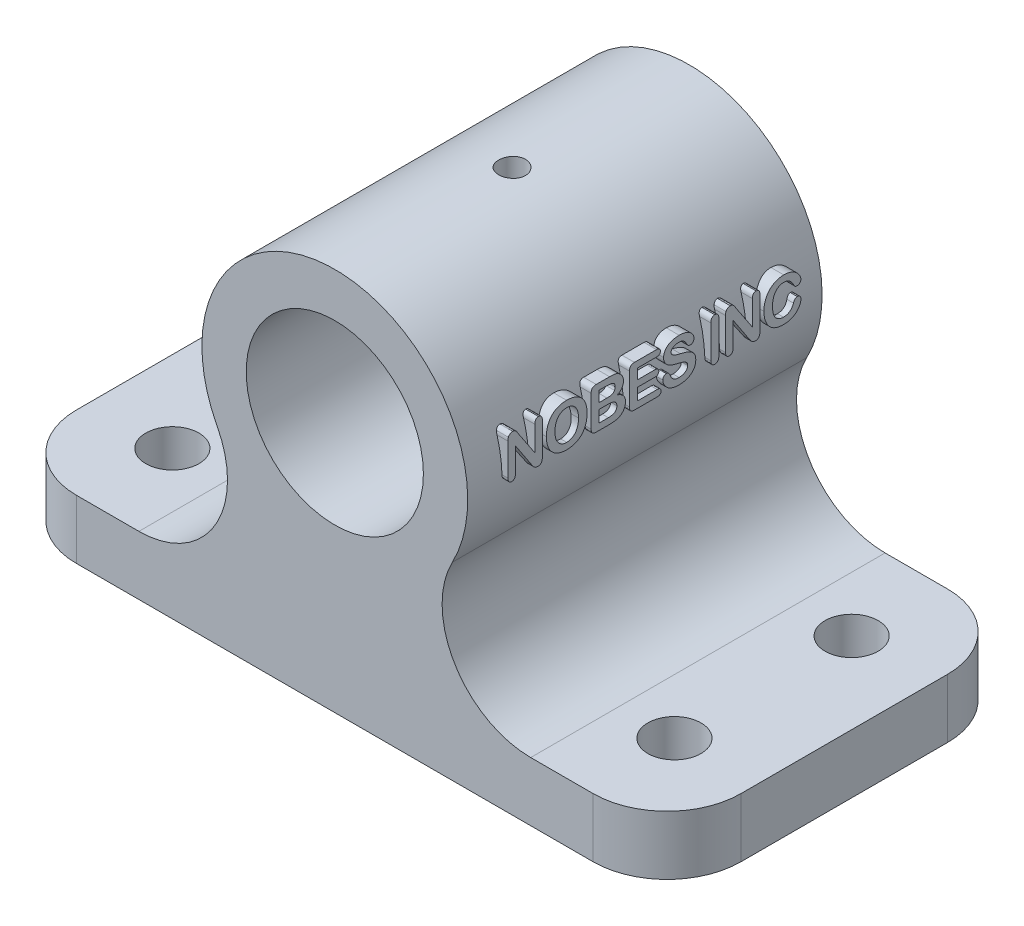
from build123d import *

# Parameters (mm, degrees)
SKETCH1_R                            = 30
MAIN_BODY_DEPTH                      = 120
FILLET1_R                            = 25
F_18_0_18_DIAMETER_HOLE1_D           = 18
LPATTERN1_COUNT                      = 2
LPATTERN1_PITCH                      = 170
LPATTERN1_COUNT_DIR2                 = 2
LPATTERN1_PITCH_DIR2                 = 60
NAME_PLATE_DEPTH                     = 7
F_1_8_27_START                       = 114.653472486
F_1_8_27_NPSM_TAPPED_HOLE1_OUTLINE_R = 4.5466
F_1_8_27_NPSM_TAPPED_HOLE1_DEPTH     = 15.346527614


# Read off the part's stored shape, not the designer's step: 1/8-27 NPSM Tapped Hole1
with BuildPart() as part:
    # Sketch1 → Main Body (new body)
    with BuildSketch(Plane.XY):
        with BuildLine():
            Line((-112.5, 0), (112.5, 0))
            Line((112.5, 0), (112.5, 20))
            Line((112.5, 20), (66.332495807, 20))
            ThreePointArc((66.332495807, 20), (40.64203065, 34.508066615), (39.799497484, 64))
            ThreePointArc((39.799497484, 64), (0, 130), (-39.799497484, 64))
            ThreePointArc((-39.799497484, 64), (-40.64203065, 34.508066615), (-66.332495807, 20))
            Line((-66.332495807, 20), (-112.5, 20))
            Line((-112.5, 20), (-112.5, 0))
        make_face()
        with Locations((0, 85)):
            Circle(SKETCH1_R, mode=Mode.SUBTRACT)
    extrude(amount=MAIN_BODY_DEPTH)

    # Fillet1
    fillet1_edges = [part.edges().sort_by_distance(p)[0] for p in [
        (112.5, 10, 120),
        (-112.5, 10, 0),
        (-112.5, 10, 120),
        (112.5, 10, 0),
    ]]
    fillet(fillet1_edges, radius=FILLET1_R)

    # Ø18.0 (18) Diameter Hole1 (through all)
    with Locations(Plane(origin=(-85, 20, 30), x_dir=(1, 0, 0), z_dir=(0, 1, 0))):
        with Locations((0, 0)):
            f_18_0_18_diameter_hole1 = Hole(F_18_0_18_DIAMETER_HOLE1_D / 2)

    # LPattern1: 18.0 _18_ Diameter Hole1 2 × 2
    with Locations(*[(i * LPATTERN1_PITCH, 0, j * LPATTERN1_PITCH_DIR2) for i in range(LPATTERN1_COUNT) for j in range(LPATTERN1_COUNT_DIR2) if (i, j) != (0, 0)]):
        add(f_18_0_18_diameter_hole1, mode=Mode.SUBTRACT)

    # Sketch5 → Name PLate (add)
    # profile 1 of 8: a face of its own
    with BuildSketch(Plane(origin=(40, 0, 0), x_dir=(0, 0, -1), z_dir=(1, 0, 0))):
        with BuildLine():
            Line((-104.804677582, 97.647629166), (-99.28003418, 89.360664063))
            Line((-99.28003418, 89.360664063), (-99.28003418, 97.724281464))
            add(Edge.make_bspline(
                [(-99.28003418, 97.724281464), (-99.275769192, 97.852300946), (-99.267780679, 98.092087141), (-99.207091884, 98.428290028), (-99.100752252, 98.7134846), (-98.950061339, 98.947686684), (-98.762706902, 99.130863217), (-98.541490145, 99.260993628), (-98.290762072, 99.340741553), (-98.113819267, 99.349385189), (-98.022368698, 99.353852539)],
                knots=[0, 0, 0, 0, 1.319117216, 2.470765316, 3.505116792, 4.43580569, 5.318756254, 6.18027265, 7.059497782, 8, 8, 8, 8], degree=3))
            add(Edge.make_bspline(
                [(-98.022368698, 99.353852539), (-97.928135636, 99.349301303), (-97.745739051, 99.340491975), (-97.48779661, 99.262367356), (-97.26235402, 99.13088627), (-97.072034794, 98.94795549), (-96.918596932, 98.71374537), (-96.808523296, 98.428899447), (-96.748809224, 98.092004635), (-96.740662782, 97.852272229), (-96.736313477, 97.724281464)],
                knots=[0, 0, 0, 0, 0.959871134, 1.857917088, 2.719075999, 3.600089629, 4.526699118, 5.554128738, 6.694173474, 8, 8, 8, 8], degree=3))
            Line((-96.736313477, 97.724281464), (-96.736313477, 86.669316711))
            add(Edge.make_bspline(
                [(-96.736313477, 86.669316711), (-96.739820547, 86.524206642), (-96.746402913, 86.251851836), (-96.81653059, 85.871028503), (-96.934795959, 85.546877405), (-97.100267179, 85.277926582), (-97.318051368, 85.066918994), (-97.587286681, 84.92188317), (-97.901195952, 84.831298278), (-98.125796777, 84.82278093), (-98.24380867, 84.818305664)],
                knots=[0, 0, 0, 0, 1.276164049, 2.395212213, 3.391561633, 4.297456637, 5.151673506, 6.027862746, 6.963780962, 8, 8, 8, 8], degree=3))
            add(Edge.make_bspline(
                [(-98.24380867, 84.818305664), (-98.36345432, 84.823919407), (-98.594218759, 84.834746814), (-98.926658891, 84.913796562), (-99.228921131, 85.061272323), (-99.50050963, 85.274513134), (-99.754759619, 85.53313818), (-99.987485044, 85.833118749), (-100.206745662, 86.158120838), (-100.356811708, 86.376998105), (-100.432657623, 86.487622375)],
                knots=[0, 0, 0, 0, 0.990229924, 1.909888509, 2.806876858, 3.75171819, 4.754420985, 5.802993103, 6.889595585, 8, 8, 8, 8], degree=3))
            Line((-100.432657623, 86.487622375), (-105.821030273, 94.629799805))
            Line((-105.821030273, 94.629799805), (-105.821030273, 86.439359818))
            add(Edge.make_bspline(
                [(-105.821030273, 86.439359818), (-105.825285388, 86.314191374), (-105.833345658, 86.07709048), (-105.895582393, 85.743685823), (-106.01007548, 85.459013677), (-106.167380468, 85.224909967), (-106.360551242, 85.042761682), (-106.581387165, 84.911627749), (-106.829199561, 84.831654192), (-107.003335632, 84.822839103), (-107.092890625, 84.818305664)],
                knots=[0, 0, 0, 0, 1.293064309, 2.449392962, 3.484384031, 4.441729672, 5.340986808, 6.204611779, 7.076664708, 8, 8, 8, 8], degree=3))
            add(Edge.make_bspline(
                [(-107.092890625, 84.818305664), (-107.184348601, 84.822669428), (-107.362497058, 84.831169484), (-107.614668655, 84.913324424), (-107.836456637, 85.048906265), (-108.030141425, 85.232082861), (-108.180846561, 85.470602294), (-108.288488586, 85.755287785), (-108.353139992, 86.086366752), (-108.360728935, 86.322649778), (-108.364750977, 86.44787674)],
                knots=[0, 0, 0, 0, 0.938889884, 1.828837584, 2.693878765, 3.596100726, 4.546832571, 5.570326044, 6.712304089, 8, 8, 8, 8], degree=3))
            Line((-108.364750977, 86.44787674), (-108.364750977, 97.292757416))
            add(Edge.make_bspline(
                [(-108.364750977, 97.292757416), (-108.363685882, 97.401688282), (-108.361671889, 97.60766629), (-108.331883202, 97.89769749), (-108.291176992, 98.152952691), (-108.240716858, 98.305787767), (-108.217124329, 98.377245483)],
                knots=[0, 0, 0, 0, 1.18793306, 2.246269525, 3.180047019, 4, 4, 4, 4], degree=3))
            add(Edge.make_bspline(
                [(-108.217124329, 98.377245483), (-108.185466238, 98.446776893), (-108.122262625, 98.58559248), (-107.983671919, 98.769528518), (-107.825490661, 98.94095732), (-107.634593653, 99.08218872), (-107.428620823, 99.202221258), (-107.21017547, 99.290935429), (-106.98186866, 99.34419169), (-106.827249873, 99.350616585), (-106.749374771, 99.353852539)],
                knots=[0, 0, 0, 0, 0.980600708, 1.957714689, 2.948627098, 3.97434472, 5.000279326, 6.011426356, 6.998437519, 8, 8, 8, 8], degree=3))
            add(Edge.make_bspline(
                [(-106.749374771, 99.353852539), (-106.633006733, 99.349222904), (-106.414795405, 99.340541492), (-106.113908987, 99.240045627), (-105.857765649, 99.092727669), (-105.636264183, 98.891644151), (-105.426828771, 98.643131131), (-105.23272042, 98.33675322), (-105.022523755, 98.000170985), (-104.878400616, 97.766935612), (-104.804677582, 97.647629166)],
                knots=[0, 0, 0, 0, 1.01695463, 1.906975685, 2.751376853, 3.592506721, 4.517315556, 5.594915983, 6.76973195, 8, 8, 8, 8], degree=3))
        make_face()
    # profile 2 of 8: a face of its own
    with BuildSketch(Plane(origin=(40, 0, 0), x_dir=(0, 0, -1), z_dir=(1, 0, 0))):
        with BuildLine():
            add(Edge.make_bspline(
                [(-88.517483749, 99.353852539), (-88.337584413, 99.351327107), (-87.984836009, 99.346375214), (-87.465623135, 99.301487649), (-86.96486712, 99.234860775), (-86.482906984, 99.138958804), (-86.020938349, 99.013820651), (-85.578873243, 98.860023686), (-85.15614202, 98.678077324), (-84.75225028, 98.471551288), (-84.371634801, 98.237764501), (-84.011872228, 97.982106556), (-83.677037518, 97.700826805), (-83.366350157, 97.396394318), (-83.081792386, 97.067978439), (-82.819227331, 96.71740267), (-82.580677572, 96.342694961), (-82.368712359, 95.943934934), (-82.17827594, 95.52708086), (-82.012964386, 95.090911), (-81.874988812, 94.637273209), (-81.760222895, 94.165416043), (-81.67324194, 93.676030116), (-81.611973923, 93.167969283), (-81.56955789, 92.643237494), (-81.566425533, 92.286786563), (-81.564836426, 92.10595192)],
                knots=[0, 0, 0, 0, 1.137132438, 2.22970057, 3.292424762, 4.329649132, 5.333981859, 6.315987487, 7.286185149, 8.241436353, 9.181332131, 10.107725602, 11.0292572, 11.943085262, 12.854854597, 13.773819033, 14.709898734, 15.660115542, 16.626635295, 17.605574315, 18.606712189, 19.622473761, 20.67399022, 21.747038223, 22.857027702, 24, 24, 24, 24], degree=3))
            add(Edge.make_bspline(
                [(-81.564836426, 92.10595192), (-81.570382149, 91.840779714), (-81.581263506, 91.320480868), (-81.663802125, 90.55877279), (-81.803721287, 89.833692768), (-81.994280785, 89.145534922), (-82.244746168, 88.499063426), (-82.549464395, 87.89512726), (-82.911433311, 87.33664155), (-83.32675324, 86.824111168), (-83.793836113, 86.360439394), (-84.315872993, 85.956224367), (-84.88962659, 85.611226023), (-85.510000354, 85.320627048), (-86.180710026, 85.091668701), (-86.900397567, 84.937738856), (-87.664617812, 84.832972381), (-88.190627523, 84.823281429), (-88.460704269, 84.818305664)],
                knots=[0, 0, 0, 0, 1.119700056, 2.196982321, 3.230778928, 4.235358115, 5.208318876, 6.153781848, 7.087131445, 8.013361148, 8.934611457, 9.860297843, 10.794468433, 11.756326826, 12.748403726, 13.780058436, 14.860183413, 16, 16, 16, 16], degree=3))
            add(Edge.make_bspline(
                [(-88.460704269, 84.818305664), (-88.72883514, 84.824761134), (-89.253749976, 84.837398887), (-90.018951277, 84.93866832), (-90.742469594, 85.101574655), (-91.42017402, 85.334500288), (-92.047330693, 85.6311208), (-92.626569284, 85.976385784), (-93.146651879, 86.384255465), (-93.614258846, 86.843087481), (-94.029352923, 87.353605495), (-94.382248018, 87.918339847), (-94.693472699, 88.524999292), (-94.939474923, 89.182582306), (-95.135195974, 89.876822816), (-95.273136548, 90.602545949), (-95.35724119, 91.355420208), (-95.368093437, 91.866311703), (-95.373605957, 92.125824738)],
                knots=[0, 0, 0, 0, 1.130091603, 2.212359386, 3.247930852, 4.252250901, 5.226719473, 6.16821431, 7.089197795, 8.00610207, 8.925165125, 9.855999165, 10.808795857, 11.79501972, 12.810514548, 13.846493258, 14.906102224, 16, 16, 16, 16], degree=3))
            add(Edge.make_bspline(
                [(-95.373605957, 92.125824738), (-95.368605529, 92.390111017), (-95.358772898, 92.909792403), (-95.267992535, 93.671177759), (-95.124662839, 94.400121624), (-94.920369867, 95.092954256), (-94.661343946, 95.744808482), (-94.34694092, 96.348575439), (-93.982928281, 96.902383673), (-93.566897212, 97.405179186), (-93.098187051, 97.853900841), (-92.579420005, 98.24632926), (-92.013149643, 98.583900844), (-91.399349943, 98.861558811), (-90.740813464, 99.084415967), (-90.037711476, 99.241759835), (-89.291365859, 99.337081064), (-88.779906348, 99.34816535), (-88.517483749, 99.353852539)],
                knots=[0, 0, 0, 0, 1.125218611, 2.212582392, 3.260701818, 4.286054269, 5.284468473, 6.243521648, 7.180287843, 8.101949555, 9.017004541, 9.937572836, 10.866572707, 11.818894766, 12.801573564, 13.82236102, 14.882684417, 16, 16, 16, 16], degree=3))
        make_face()
        with BuildLine():
            add(Edge.make_bspline(
                [(-84.471945801, 92.125824738), (-84.47749754, 92.378806646), (-84.488246995, 92.86863825), (-84.583516947, 93.577215725), (-84.737824848, 94.234456256), (-84.921740614, 94.743358829), (-85.098345245, 95.12058141), (-85.242577904, 95.383129447), (-85.397729789, 95.630305923), (-85.573823752, 95.853875821), (-85.756487156, 96.064504191), (-85.954252899, 96.2572242), (-86.167465493, 96.429166306), (-86.466247678, 96.637861495), (-86.868607256, 96.854106381), (-87.388117195, 97.039405572), (-87.941895454, 97.15359428), (-88.32293407, 97.166785414), (-88.517483749, 97.173520508)],
                knots=[0, 0, 0, 0, 1.663767962, 3.22144036, 4.693807908, 6.09809827, 6.772124886, 7.43249818, 8.068074837, 8.689496673, 9.30272399, 9.901527182, 10.503429657, 11.102750509, 12.297797107, 13.495176895, 14.721094103, 16, 16, 16, 16], degree=3))
            add(Edge.make_bspline(
                [(-88.517483749, 97.173520508), (-88.656842471, 97.17005393), (-88.932271691, 97.163202568), (-89.336591849, 97.098135873), (-89.724979584, 96.996378529), (-90.095627902, 96.854054432), (-90.445235877, 96.67229926), (-90.772239507, 96.451636288), (-91.072695605, 96.192924552), (-91.34828595, 95.897211667), (-91.597363617, 95.561517908), (-91.818341885, 95.182361103), (-92.010879749, 94.759736153), (-92.175025666, 94.297414046), (-92.304849026, 93.797772121), (-92.39716001, 93.266048872), (-92.455149633, 92.705307081), (-92.462658013, 92.321858309), (-92.466496582, 92.125824738)],
                knots=[0, 0, 0, 0, 0.926902171, 1.831933723, 2.71800685, 3.595261319, 4.468550136, 5.334998465, 6.214894287, 7.1017058, 8.020008637, 8.99111482, 10.01694856, 11.106630737, 12.25237115, 13.448355624, 14.695502513, 16, 16, 16, 16], degree=3))
            add(Edge.make_bspline(
                [(-92.466496582, 92.125824738), (-92.462647417, 91.927902067), (-92.455116858, 91.540683488), (-92.397245589, 90.974251457), (-92.304332011, 90.436073224), (-92.175435731, 89.928376194), (-92.008680489, 89.457079223), (-91.808500031, 89.02650081), (-91.584088797, 88.633569686), (-91.319349244, 88.289242084), (-91.033386302, 87.985389756), (-90.726060568, 87.720736367), (-90.399589657, 87.495279564), (-90.050847279, 87.311736034), (-89.68174531, 87.174021118), (-89.296363949, 87.069650991), (-88.892201328, 87.010037727), (-88.617035341, 87.00246914), (-88.477738113, 86.998637695)],
                knots=[0, 0, 0, 0, 1.300369924, 2.54406124, 3.737115199, 4.88637188, 5.981883645, 7.016846829, 8.003376514, 8.948590554, 9.863559023, 10.741055788, 11.608647785, 12.46534091, 13.323432129, 14.192248925, 15.0848625, 16, 16, 16, 16], degree=3))
            add(Edge.make_bspline(
                [(-88.477738113, 86.998637695), (-88.298326414, 87.004646722), (-87.944824468, 87.016486543), (-87.42720414, 87.127034257), (-86.932653385, 87.300844902), (-86.541076411, 87.500972607), (-86.245954545, 87.698110759), (-86.032689016, 87.864427522), (-85.834427063, 88.053688048), (-85.64544727, 88.258586481), (-85.470332722, 88.483590625), (-85.304535068, 88.725847015), (-85.151458204, 88.987945533), (-85.009835502, 89.268420784), (-84.881940436, 89.566762535), (-84.770386351, 89.882178478), (-84.681457718, 90.216055226), (-84.603843224, 90.565292063), (-84.544798149, 90.932186152), (-84.502811289, 91.314980104), (-84.476503813, 91.714750801), (-84.47348872, 91.98667331), (-84.471945801, 92.125824738)],
                knots=[0, 0, 0, 0, 1.468568495, 2.893578421, 4.316075305, 5.755382189, 6.482330971, 7.222315454, 7.968369796, 8.725783183, 9.504530818, 10.302500265, 11.129737207, 11.9897977, 12.875655565, 13.787998707, 14.728608307, 15.705132475, 16.718642732, 17.771954593, 18.859838044, 20, 20, 20, 20], degree=3))
        make_face(mode=Mode.SUBTRACT)
    # profile 3 of 8: a face of its own
    with BuildSketch(Plane(origin=(40, 0, 0), x_dir=(0, 0, -1), z_dir=(1, 0, 0))):
        with BuildLine():
            Line((-74.223249664, 85), (-78.487388611, 85))
            add(Edge.make_bspline(
                [(-78.487388611, 85), (-78.562194975, 85.000763884), (-78.705478808, 85.002227025), (-78.91244954, 85.022358176), (-79.102145449, 85.056313788), (-79.276144912, 85.101221206), (-79.434383588, 85.158147864), (-79.576926764, 85.227455387), (-79.700125646, 85.315167492), (-79.847826283, 85.444883294), (-79.996940134, 85.656181978), (-80.116429591, 85.965020037), (-80.189719342, 86.331900674), (-80.197802672, 86.596068357), (-80.202128906, 86.737452087)],
                knots=[0, 0, 0, 0, 0.950729654, 1.821024047, 2.639907261, 3.398604693, 4.102683231, 4.775219685, 5.406000082, 6.019447712, 7.268382492, 8.644570224, 10.204158913, 12, 12, 12, 12], degree=3))
            Line((-80.202128906, 86.737452087), (-80.202128906, 97.25301178))
            add(Edge.make_bspline(
                [(-80.202128906, 97.25301178), (-80.198193204, 97.397297808), (-80.190876216, 97.665544473), (-80.113830527, 98.036065169), (-79.992103911, 98.345800849), (-79.809069281, 98.595284152), (-79.562402087, 98.779206052), (-79.255652921, 98.902840089), (-78.891332167, 98.978511448), (-78.627858049, 98.986307471), (-78.487388611, 98.990463867)],
                knots=[0, 0, 0, 0, 1.222174323, 2.272182497, 3.193385757, 4.024939207, 4.86132091, 5.767718531, 6.809874283, 8, 8, 8, 8], degree=3))
            Line((-78.487388611, 98.990463867), (-73.967742004, 98.990463867))
            add(Edge.make_bspline(
                [(-73.967742004, 98.990463867), (-73.806845874, 98.988640259), (-73.495297636, 98.98510915), (-73.045296211, 98.96349596), (-72.628478788, 98.923699145), (-72.241994911, 98.868750057), (-71.881251617, 98.78862795), (-71.540092989, 98.685696922), (-71.220891084, 98.544859171), (-71.020923109, 98.43100247), (-70.921522903, 98.374406509)],
                knots=[0, 0, 0, 0, 1.226361742, 2.374642816, 3.432537546, 4.416889029, 5.347867328, 6.246718495, 7.128477734, 8, 8, 8, 8], degree=3))
            add(Edge.make_bspline(
                [(-70.921522903, 98.374406509), (-70.839204676, 98.322789208), (-70.674576039, 98.219559508), (-70.444470844, 98.039950523), (-70.230675398, 97.838767642), (-70.030234552, 97.622442426), (-69.847959449, 97.389445819), (-69.688394239, 97.14279471), (-69.555403612, 96.881973572), (-69.441137987, 96.612041616), (-69.349292326, 96.332325404), (-69.288714835, 96.042721557), (-69.245579929, 95.746813526), (-69.242437397, 95.54600266), (-69.240850296, 95.444585342)],
                knots=[0, 0, 0, 0, 0.989179716, 1.978265507, 2.967116444, 3.97665542, 4.979268596, 5.976539418, 6.963744816, 7.957282277, 8.960127083, 9.956465876, 10.967935579, 12, 12, 12, 12], degree=3))
            add(Edge.make_bspline(
                [(-69.240850296, 95.444585342), (-69.2471443, 95.273714847), (-69.259391395, 94.941229022), (-69.362017373, 94.460881629), (-69.526590512, 94.014390733), (-69.762826947, 93.604710412), (-70.064923779, 93.230379994), (-70.437480717, 92.897823204), (-70.872088223, 92.596413626), (-71.19650346, 92.43410543), (-71.364402847, 92.350103683)],
                knots=[0, 0, 0, 0, 1.026786861, 1.997958018, 2.939919024, 3.878158348, 4.829291737, 5.820536811, 6.872030375, 8, 8, 8, 8], degree=3))
            add(Edge.make_bspline(
                [(-71.364402847, 92.350103683), (-71.251317206, 92.31260608), (-71.030617788, 92.239425265), (-70.714560137, 92.110159008), (-70.418454601, 91.97251555), (-70.144759022, 91.819247094), (-69.894641923, 91.650315357), (-69.662911824, 91.472501135), (-69.455677065, 91.278706571), (-69.269256902, 91.07279808), (-69.104749111, 90.854381314), (-68.960877534, 90.62308588), (-68.843162211, 90.377516287), (-68.740690633, 90.12160073), (-68.670175493, 89.849053576), (-68.610695499, 89.566340033), (-68.581053265, 89.269497184), (-68.576172092, 89.068298751), (-68.573691406, 88.966046677)],
                knots=[0, 0, 0, 0, 1.203679095, 2.349115882, 3.448557464, 4.501905559, 5.515114208, 6.496455107, 7.450530545, 8.378166232, 9.30006595, 10.210385309, 11.125664208, 12.049149821, 12.991069707, 13.966334133, 14.966460368, 16, 16, 16, 16], degree=3))
            add(Edge.make_bspline(
                [(-68.573691406, 88.966046677), (-68.580055264, 88.777076778), (-68.592621803, 88.403923024), (-68.714469979, 87.860976968), (-68.905054179, 87.345617569), (-69.173111552, 86.868077861), (-69.501141246, 86.432627519), (-69.888208019, 86.054215211), (-70.330110983, 85.735485971), (-70.658523923, 85.578988588), (-70.824997787, 85.499659424)],
                knots=[0, 0, 0, 0, 1.034007292, 2.041826266, 3.032819392, 4.03550363, 5.031030359, 6.010000582, 6.991261149, 8, 8, 8, 8], degree=3))
            add(Edge.make_bspline(
                [(-70.824997787, 85.499659424), (-70.935123037, 85.455444775), (-71.160023358, 85.365148601), (-71.516104599, 85.258019883), (-71.896138586, 85.174406261), (-72.30050824, 85.105130758), (-72.733967533, 85.058952116), (-73.199875537, 85.025820592), (-73.699678009, 85.001436377), (-74.045309155, 85.000488166), (-74.223249664, 85)],
                knots=[0, 0, 0, 0, 0.823393962, 1.68155411, 2.577109222, 3.523060306, 4.5276929, 5.601251204, 6.765057529, 8, 8, 8, 8], degree=3))
        make_face()
        with BuildLine():
            Line((-74.487274246, 91.177607422), (-77.476713867, 91.177607422))
            Line((-77.476713867, 91.177607422), (-77.476713867, 87.180332031))
            Line((-77.476713867, 87.180332031), (-74.39074913, 87.180332031))
            add(Edge.make_bspline(
                [(-74.39074913, 87.180332031), (-74.273370383, 87.182124598), (-74.045957086, 87.185597574), (-73.71604985, 87.207767937), (-73.408667294, 87.246654618), (-73.123457436, 87.304080778), (-72.860402821, 87.373955833), (-72.618518569, 87.457830265), (-72.402678253, 87.564029031), (-72.208225354, 87.683157514), (-72.035304539, 87.816994877), (-71.88746058, 87.968684248), (-71.759255461, 88.135236161), (-71.65904615, 88.320156396), (-71.576902219, 88.519572169), (-71.52192714, 88.735576303), (-71.486819369, 88.966790687), (-71.482840212, 89.125841457), (-71.480800781, 89.207359467)],
                knots=[0, 0, 0, 0, 1.397840841, 2.708221037, 3.935522691, 5.08480215, 6.170083952, 7.175292938, 8.127891873, 9.028615238, 9.887548979, 10.724312948, 11.544753106, 12.382123976, 13.221312913, 14.106963916, 15.029765574, 16, 16, 16, 16], degree=3))
            add(Edge.make_bspline(
                [(-71.480800781, 89.207359467), (-71.482506321, 89.290809632), (-71.485819302, 89.452910115), (-71.524856595, 89.685685919), (-71.580466017, 89.902757775), (-71.662404423, 90.10219741), (-71.77119398, 90.282737617), (-71.904927168, 90.443378288), (-72.057676808, 90.589702012), (-72.237491133, 90.714120109), (-72.437126233, 90.826847302), (-72.663652612, 90.917687126), (-72.910210647, 91.001731032), (-73.181484969, 91.06525025), (-73.474403851, 91.116022939), (-73.790878819, 91.153458688), (-74.131248423, 91.171432307), (-74.366129059, 91.175506211), (-74.487274246, 91.177607422)],
                knots=[0, 0, 0, 0, 0.978374407, 1.900475129, 2.762565409, 3.604092296, 4.421226212, 5.226116304, 6.051062672, 6.895443069, 7.785413459, 8.736294548, 9.754820785, 10.840413303, 12.001711888, 13.242950972, 14.577987407, 16, 16, 16, 16], degree=3))
        make_face(mode=Mode.SUBTRACT)
        with BuildLine():
            Line((-77.476713867, 96.810131836), (-77.476713867, 93.176245117))
            Line((-77.476713867, 93.176245117), (-74.84498497, 93.176245117))
            add(Edge.make_bspline(
                [(-74.84498497, 93.176245117), (-74.676441103, 93.177570677), (-74.358685554, 93.180069753), (-73.912920187, 93.22050325), (-73.526968902, 93.280544017), (-73.194436492, 93.365388914), (-72.909900042, 93.493612884), (-72.662551469, 93.662738261), (-72.454944199, 93.883807571), (-72.34762506, 94.056188266), (-72.292747345, 94.144335251)],
                knots=[0, 0, 0, 0, 1.403565858, 2.64614101, 3.724413317, 4.655733905, 5.495397674, 6.311071983, 7.136365515, 8, 8, 8, 8], degree=3))
            add(Edge.make_bspline(
                [(-72.292747345, 94.144335251), (-72.254457217, 94.212369552), (-72.177764059, 94.348638756), (-72.10468243, 94.572263122), (-72.051608673, 94.805214943), (-72.04773315, 94.965422194), (-72.045756607, 95.047128983)],
                knots=[0, 0, 0, 0, 0.986348614, 1.975605531, 2.967545036, 4, 4, 4, 4], degree=3))
            add(Edge.make_bspline(
                [(-72.045756607, 95.047128983), (-72.047396916, 95.132464299), (-72.050530921, 95.295507541), (-72.089053962, 95.528782155), (-72.147571881, 95.739854102), (-72.229499735, 95.930580752), (-72.339770903, 96.097870623), (-72.473032613, 96.24398516), (-72.633228711, 96.364147334), (-72.815054007, 96.464637865), (-73.021379381, 96.54498437), (-73.251197914, 96.615912013), (-73.504907726, 96.678782118), (-73.785263249, 96.724523912), (-74.088863451, 96.76633142), (-74.417957046, 96.788697579), (-74.771901011, 96.807569512), (-75.016238039, 96.809256233), (-75.14307724, 96.810131836)],
                knots=[0, 0, 0, 0, 1.003025396, 1.916398969, 2.77282862, 3.575462095, 4.347472474, 5.119643405, 5.89012688, 6.692528659, 7.556738954, 8.489916057, 9.521455324, 10.628856332, 11.830320039, 13.125714765, 14.507913242, 16, 16, 16, 16], degree=3))
            Line((-75.14307724, 96.810131836), (-77.476713867, 96.810131836))
        make_face(mode=Mode.SUBTRACT)
    # profile 4 of 8: a face of its own
    with BuildSketch(Plane(origin=(40, 0, 0), x_dir=(0, 0, -1), z_dir=(1, 0, 0))):
        with BuildLine():
            Line((-58.075165558, 96.810131836), (-64.485568848, 96.810131836))
            Line((-64.485568848, 96.810131836), (-64.485568848, 93.357939453))
            Line((-64.485568848, 93.357939453), (-58.583341904, 93.357939453))
            add(Edge.make_bspline(
                [(-58.583341904, 93.357939453), (-58.480919383, 93.354063198), (-58.28866637, 93.346787242), (-58.019548574, 93.2953215), (-57.791949992, 93.200858646), (-57.606789007, 93.069038886), (-57.464584531, 92.905086836), (-57.360050204, 92.718181978), (-57.298937383, 92.504276535), (-57.29224826, 92.354287928), (-57.28876976, 92.276290359)],
                knots=[0, 0, 0, 0, 1.285293232, 2.412569968, 3.418386025, 4.354403319, 5.23810445, 6.120527863, 7.022630715, 8, 8, 8, 8], degree=3))
            add(Edge.make_bspline(
                [(-57.28876976, 92.276290359), (-57.292150532, 92.198244999), (-57.298651725, 92.04816449), (-57.361189654, 91.834533862), (-57.461865199, 91.643701921), (-57.602708788, 91.476301549), (-57.786336655, 91.339620728), (-58.014512253, 91.242802951), (-58.285525636, 91.188003489), (-58.479929044, 91.181217322), (-58.583341904, 91.177607422)],
                knots=[0, 0, 0, 0, 0.971200242, 1.867609123, 2.749214551, 3.645234956, 4.57279535, 5.576919765, 6.711042891, 8, 8, 8, 8], degree=3))
            Line((-58.583341904, 91.177607422), (-64.485568848, 91.177607422))
            Line((-64.485568848, 91.177607422), (-64.485568848, 87.180332031))
            Line((-64.485568848, 87.180332031), (-57.853725586, 87.180332031))
            add(Edge.make_bspline(
                [(-57.853725586, 87.180332031), (-57.748486308, 87.176394195), (-57.550647719, 87.168991485), (-57.271792577, 87.117871941), (-57.035481121, 87.020767521), (-56.840344817, 86.887832269), (-56.686134905, 86.724670968), (-56.580062895, 86.530655247), (-56.511162081, 86.314325596), (-56.505361283, 86.160742167), (-56.502373962, 86.081649094)],
                knots=[0, 0, 0, 0, 1.281412047, 2.408917619, 3.431661904, 4.368016538, 5.264760761, 6.136510243, 7.040331808, 8, 8, 8, 8], degree=3))
            add(Edge.make_bspline(
                [(-56.502373962, 86.081649094), (-56.505205404, 86.004387521), (-56.510669167, 85.855297757), (-56.581306179, 85.645182728), (-56.68690167, 85.455159374), (-56.840375813, 85.292704628), (-57.034823879, 85.158757582), (-57.272893564, 85.067004454), (-57.550121787, 85.009980906), (-57.748369161, 85.003463569), (-57.853725586, 85)],
                knots=[0, 0, 0, 0, 0.944744106, 1.823049547, 2.692159438, 3.596595969, 4.540982691, 5.5681055, 6.707595947, 8, 8, 8, 8], degree=3))
            Line((-57.853725586, 85), (-65.541667175, 85))
            add(Edge.make_bspline(
                [(-65.541667175, 85), (-65.680254462, 85.004033081), (-65.938150186, 85.011538201), (-66.295463298, 85.087776638), (-66.593290807, 85.213877842), (-66.834016071, 85.399391448), (-67.008045425, 85.651303328), (-67.129546808, 85.959769856), (-67.197308257, 86.329546615), (-67.206215363, 86.595220487), (-67.210983887, 86.737452087)],
                knots=[0, 0, 0, 0, 1.189456171, 2.21344733, 3.119993849, 3.948013107, 4.78741338, 5.71757596, 6.778077714, 8, 8, 8, 8], degree=3))
            Line((-67.210983887, 86.737452087), (-67.210983887, 97.25301178))
            add(Edge.make_bspline(
                [(-67.210983887, 97.25301178), (-67.208801262, 97.350573203), (-67.204656701, 97.535831437), (-67.173830823, 97.800283154), (-67.121381334, 98.037045639), (-67.04421983, 98.247211098), (-66.945709171, 98.432200006), (-66.817954548, 98.588762912), (-66.665272349, 98.717451988), (-66.488934295, 98.821861047), (-66.286374883, 98.896513158), (-66.06123182, 98.95459403), (-65.809272898, 98.983580233), (-65.633517423, 98.988101199), (-65.541667175, 98.990463867)],
                knots=[0, 0, 0, 0, 1.257097402, 2.387087425, 3.425508426, 4.374733264, 5.264346199, 6.113849079, 6.961774747, 7.825601221, 8.740599092, 9.73444991, 10.816017894, 12, 12, 12, 12], degree=3))
            Line((-65.541667175, 98.990463867), (-58.075165558, 98.990463867))
            add(Edge.make_bspline(
                [(-58.075165558, 98.990463867), (-57.969015854, 98.986442468), (-57.769368333, 98.978878976), (-57.489049992, 98.929048013), (-57.254262731, 98.830587355), (-57.061024482, 98.699074171), (-56.91569531, 98.533547843), (-56.805295055, 98.346932767), (-56.742547347, 98.133220469), (-56.73579459, 97.983019383), (-56.732330856, 97.9059758)],
                knots=[0, 0, 0, 0, 1.304353081, 2.453241492, 3.474309848, 4.409392115, 5.298405909, 6.157667996, 7.055001114, 8, 8, 8, 8], degree=3))
            add(Edge.make_bspline(
                [(-56.732330856, 97.9059758), (-56.735659312, 97.826999154), (-56.742111045, 97.673914251), (-56.80614529, 97.456234381), (-56.913815675, 97.264959113), (-57.061324071, 97.099007924), (-57.253557764, 96.966521652), (-57.489839077, 96.872483209), (-57.769237307, 96.821412727), (-57.968970371, 96.81404771), (-58.075165558, 96.810131836)],
                knots=[0, 0, 0, 0, 0.962139494, 1.864969442, 2.738963821, 3.622448103, 4.551714319, 5.562017248, 6.70375977, 8, 8, 8, 8], degree=3))
        make_face()
    # profile 5 of 8: a face of its own
    with BuildSketch(Plane(origin=(40, 0, 0), x_dir=(0, 0, -1), z_dir=(1, 0, 0))):
        with BuildLine():
            add(Edge.make_bspline(
                [(-44.771733398, 89.352147141), (-44.77407188, 89.245136544), (-44.778696681, 89.033502314), (-44.810779544, 88.720502912), (-44.861795135, 88.416067464), (-44.932059689, 88.119511101), (-45.026596743, 87.832383207), (-45.14126645, 87.552979811), (-45.272951967, 87.279969498), (-45.431350947, 87.018688925), (-45.605057547, 86.766918977), (-45.800812068, 86.529702313), (-46.012382619, 86.304691967), (-46.248022218, 86.097296075), (-46.500022348, 85.901651733), (-46.770966822, 85.719000786), (-47.061455909, 85.551614963), (-47.370350342, 85.398454062), (-47.696869615, 85.262693396), (-48.038274038, 85.144002199), (-48.393702683, 85.039273545), (-48.765841064, 84.963903689), (-49.150581009, 84.895455518), (-49.551807902, 84.852405265), (-49.967535639, 84.822212454), (-50.249948918, 84.81961862), (-50.392901917, 84.818305664)],
                knots=[0, 0, 0, 0, 0.94904565, 1.876922008, 2.787632434, 3.685409961, 4.577243309, 5.465673456, 6.362823001, 7.262481841, 8.172882791, 9.073480814, 9.987781212, 10.909257821, 11.854472834, 12.815908446, 13.804938933, 14.825933836, 15.871877953, 16.938992789, 18.030809531, 19.155177508, 20.304610591, 21.495671913, 22.732349945, 24, 24, 24, 24], degree=3))
            add(Edge.make_bspline(
                [(-50.392901917, 84.818305664), (-50.563287403, 84.821514842), (-50.897830653, 84.8278159), (-51.388273821, 84.862923419), (-51.855151916, 84.930006287), (-52.300618142, 85.016176327), (-52.722989941, 85.132099136), (-53.121427754, 85.275740024), (-53.499995585, 85.437495729), (-53.734602174, 85.5721115), (-53.850772247, 85.63876915)],
                knots=[0, 0, 0, 0, 1.136969792, 2.232382444, 3.278022597, 4.282276305, 5.258039159, 6.196692155, 7.1070566, 8, 8, 8, 8], degree=3))
            add(Edge.make_bspline(
                [(-53.850772247, 85.63876915), (-54.001331489, 85.738065973), (-54.300901792, 85.935638564), (-54.698370517, 86.300961939), (-55.060067078, 86.704331679), (-55.366874278, 87.151458987), (-55.61817705, 87.616825004), (-55.803104926, 88.084976094), (-55.916996522, 88.548976339), (-55.932613251, 88.857580164), (-55.940257111, 89.008631287)],
                knots=[0, 0, 0, 0, 1.048405233, 2.086029851, 3.131870059, 4.19698972, 5.234628962, 6.204463721, 7.121145791, 8, 8, 8, 8], degree=3))
            add(Edge.make_bspline(
                [(-55.940257111, 89.008631287), (-55.93594028, 89.093297447), (-55.927509239, 89.258655748), (-55.859844854, 89.49615998), (-55.749078754, 89.713190616), (-55.600069083, 89.908874922), (-55.413337618, 90.070321667), (-55.198868625, 90.188972458), (-54.960014835, 90.26391282), (-54.791986306, 90.271103927), (-54.705303421, 90.27481369)],
                knots=[0, 0, 0, 0, 1.029346977, 2.010378973, 2.978887221, 3.98112847, 4.985683985, 5.960201932, 6.947705008, 8, 8, 8, 8], degree=3))
            add(Edge.make_bspline(
                [(-54.705303421, 90.27481369), (-54.634872853, 90.272078502), (-54.498376369, 90.266777627), (-54.302426738, 90.209668757), (-54.124163332, 90.117864818), (-53.962855502, 89.988454205), (-53.814065452, 89.828086695), (-53.681055833, 89.630272842), (-53.555268007, 89.401087678), (-53.488302227, 89.230951096), (-53.453315887, 89.142063065)],
                knots=[0, 0, 0, 0, 0.932433643, 1.807083439, 2.683354794, 3.577798377, 4.537574086, 5.575745438, 6.73344572, 8, 8, 8, 8], degree=3))
            add(Edge.make_bspline(
                [(-53.453315887, 89.142063065), (-53.406811842, 89.034776591), (-53.317052745, 88.827699186), (-53.173651162, 88.53295511), (-53.018056753, 88.269835911), (-52.863586212, 88.025470328), (-52.684088178, 87.806357986), (-52.470723095, 87.613601659), (-52.227918905, 87.436201387), (-51.950452189, 87.27854264), (-51.633057288, 87.14831304), (-51.268790262, 87.064773525), (-50.863284464, 87.00529672), (-50.57674056, 87.000923495), (-50.426969604, 86.998637695)],
                knots=[0, 0, 0, 0, 1.049400523, 2.025484958, 2.938775158, 3.791458515, 4.617854192, 5.471340711, 6.364831691, 7.311813007, 8.329001391, 9.430967745, 10.65721654, 12, 12, 12, 12], degree=3))
            add(Edge.make_bspline(
                [(-50.426969604, 86.998637695), (-50.32090241, 86.999918481), (-50.113098081, 87.002427767), (-49.809816475, 87.032407554), (-49.52091615, 87.075998527), (-49.249496954, 87.143078629), (-48.990396829, 87.22016759), (-48.749469736, 87.324435551), (-48.521742295, 87.442609611), (-48.311831261, 87.578843019), (-48.121715623, 87.728990047), (-47.953799923, 87.8894111), (-47.813025673, 88.061339526), (-47.699162574, 88.242124018), (-47.605632647, 88.429399175), (-47.545107024, 88.628255417), (-47.501623315, 88.83450851), (-47.498658293, 88.976216175), (-47.497148438, 89.048376923)],
                knots=[0, 0, 0, 0, 1.280104897, 2.507951138, 3.676307556, 4.80418709, 5.881088807, 6.935759984, 7.968101261, 8.975871649, 9.951925376, 10.889226907, 11.77430911, 12.626938706, 13.464975202, 14.292430499, 15.130466995, 16, 16, 16, 16], degree=3))
            add(Edge.make_bspline(
                [(-47.497148438, 89.048376923), (-47.502302839, 89.159675053), (-47.512238739, 89.374219283), (-47.59700964, 89.678533427), (-47.735250453, 89.950735028), (-47.933924132, 90.183560586), (-48.172009131, 90.387358723), (-48.442726626, 90.567025807), (-48.747289511, 90.716763604), (-49.086542763, 90.845625891), (-49.471846149, 90.95950209), (-49.908132178, 91.083538585), (-50.405392131, 91.202674817), (-50.756221828, 91.282979028), (-50.940823898, 91.32523407)],
                knots=[0, 0, 0, 0, 0.889216893, 1.714102054, 2.506617733, 3.313297162, 4.145346194, 5.008548814, 5.905982136, 6.85524107, 7.90915739, 9.119934543, 10.484546625, 12, 12, 12, 12], degree=3))
            add(Edge.make_bspline(
                [(-50.940823898, 91.32523407), (-51.182690454, 91.384641685), (-51.648164543, 91.498972107), (-52.310583316, 91.69756269), (-52.911238526, 91.910794999), (-53.457104484, 92.13472837), (-53.945385903, 92.393610648), (-54.380305913, 92.693333878), (-54.758820437, 93.039148609), (-55.034184063, 93.360163387), (-55.219183499, 93.640430901), (-55.342832867, 93.862555938), (-55.444569254, 94.098685393), (-55.526548962, 94.346984377), (-55.591768851, 94.606048433), (-55.640590961, 94.877160663), (-55.669252556, 95.161007965), (-55.671997367, 95.354619137), (-55.673393555, 95.453102264)],
                knots=[0, 0, 0, 0, 1.736501148, 3.341910126, 4.819600125, 6.179978285, 7.452384316, 8.666026066, 9.852526874, 11.018500134, 11.604160195, 12.191898388, 12.788898658, 13.394048862, 14.013423104, 14.650267458, 15.313438986, 16, 16, 16, 16], degree=3))
            add(Edge.make_bspline(
                [(-55.673393555, 95.453102264), (-55.672379746, 95.547852965), (-55.670376686, 95.735059334), (-55.635584945, 96.011606897), (-55.590853764, 96.281218218), (-55.516629006, 96.541052558), (-55.42997359, 96.794194993), (-55.322136707, 97.040022524), (-55.189867652, 97.274625413), (-55.043374386, 97.50309487), (-54.874661242, 97.71832402), (-54.689691103, 97.924218895), (-54.485428557, 98.116829071), (-54.263496873, 98.295050629), (-54.026491544, 98.461847103), (-53.769265567, 98.611960622), (-53.494515381, 98.749585111), (-53.102501042, 98.924157022), (-52.570968766, 99.097859937), (-51.888419939, 99.248780708), (-51.15219634, 99.3357422), (-50.643906809, 99.347687041), (-50.381546021, 99.353852539)],
                knots=[0, 0, 0, 0, 0.769447055, 1.520256708, 2.262508943, 2.988321943, 3.713156319, 4.436274914, 5.166110871, 5.89994773, 6.639925254, 7.385953261, 8.147635144, 8.918771606, 9.697541001, 10.500837489, 11.336648996, 12.194084557, 13.986552036, 15.869357873, 17.867910982, 20, 20, 20, 20], degree=3))
            add(Edge.make_bspline(
                [(-50.381546021, 99.353852539), (-50.172253604, 99.350341079), (-49.767903014, 99.343556979), (-49.18319721, 99.283084163), (-48.642412407, 99.1858178), (-48.145414326, 99.046910026), (-47.693351105, 98.870110774), (-47.275246336, 98.678515044), (-46.902840373, 98.448759642), (-46.569757942, 98.199092183), (-46.27875074, 97.933850504), (-46.028895649, 97.658997896), (-45.819671219, 97.378403672), (-45.655493345, 97.089945885), (-45.526248566, 96.802921199), (-45.434680602, 96.517363585), (-45.377478823, 96.23422782), (-45.371076767, 96.045755536), (-45.367917938, 95.952761688)],
                knots=[0, 0, 0, 0, 1.501690988, 2.90125006, 4.213360721, 5.441058994, 6.597662568, 7.694391675, 8.736870916, 9.731158549, 10.678212085, 11.558107852, 12.393499291, 13.184506524, 13.935459515, 14.648542639, 15.3331793, 16, 16, 16, 16], degree=3))
            add(Edge.make_bspline(
                [(-45.367917938, 95.952761688), (-45.372354924, 95.869992865), (-45.381117041, 95.706541793), (-45.449499938, 95.468198465), (-45.562342064, 95.244858052), (-45.714241785, 95.039737122), (-45.897679904, 94.86393105), (-46.110887646, 94.735651698), (-46.346407058, 94.654545327), (-46.512310026, 94.645687683), (-46.59719368, 94.641155701)],
                knots=[0, 0, 0, 0, 0.996822281, 1.968514991, 2.963507279, 3.999520829, 5.032703306, 6.005199511, 6.979367534, 8, 8, 8, 8], degree=3))
            add(Edge.make_bspline(
                [(-46.59719368, 94.641155701), (-46.672161191, 94.643739882), (-46.813807439, 94.648622524), (-47.012257156, 94.688308925), (-47.183710289, 94.752504994), (-47.33037046, 94.84912866), (-47.46037642, 94.977718688), (-47.589471571, 95.13645331), (-47.730215171, 95.322813427), (-47.817255303, 95.46364678), (-47.863376083, 95.538271484)],
                knots=[0, 0, 0, 0, 1.091449335, 2.062222683, 2.935356023, 3.742291246, 4.60049062, 5.589116983, 6.722522559, 8, 8, 8, 8], degree=3))
            add(Edge.make_bspline(
                [(-47.863376083, 95.538271484), (-47.929905247, 95.674949443), (-48.05827962, 95.938682612), (-48.286107119, 96.299715857), (-48.537878884, 96.610022469), (-48.763125271, 96.838112391), (-48.961782805, 96.995086742), (-49.135130642, 97.090877674), (-49.327844368, 97.171810374), (-49.540071493, 97.241562857), (-49.77440496, 97.290941132), (-50.029539031, 97.32726827), (-50.305434932, 97.350113479), (-50.496006423, 97.353477008), (-50.59446907, 97.355214844)],
                knots=[0, 0, 0, 0, 1.547925219, 2.986869477, 4.337480217, 5.612327564, 6.244828973, 6.909713596, 7.622436063, 8.372459485, 9.181850378, 10.058552105, 10.996911345, 12, 12, 12, 12], degree=3))
            add(Edge.make_bspline(
                [(-50.59446907, 97.355214844), (-50.775552991, 97.34921049), (-51.121129121, 97.337751929), (-51.614093377, 97.251836357), (-52.050947923, 97.097577481), (-52.371588749, 96.919610181), (-52.59533634, 96.756094262), (-52.736357968, 96.624984803), (-52.859070034, 96.491149323), (-52.955503272, 96.347628363), (-53.032722383, 96.199128433), (-53.092059927, 96.044589403), (-53.122078699, 95.88200103), (-53.127140218, 95.772112041), (-53.129672852, 95.717126846)],
                knots=[0, 0, 0, 0, 1.954508865, 3.729936959, 5.377867423, 6.932763574, 7.670377485, 8.364471239, 9.008409927, 9.626125187, 10.224705099, 10.812996495, 11.406058616, 12, 12, 12, 12], degree=3))
            add(Edge.make_bspline(
                [(-53.129672852, 95.717126846), (-53.127265375, 95.649672451), (-53.122527943, 95.516935707), (-53.07576632, 95.325897877), (-53.000250064, 95.148923755), (-52.897213493, 94.985566471), (-52.765175084, 94.837839345), (-52.608160045, 94.705422282), (-52.436670668, 94.575160389), (-52.172706925, 94.427783438), (-51.828740682, 94.266739828), (-51.460256341, 94.138886699), (-51.1277604, 94.049650533), (-50.810191338, 93.968485184), (-50.424948661, 93.867581422), (-50.144160377, 93.800252901), (-49.992606583, 93.763912735)],
                knots=[0, 0, 0, 0, 0.710476229, 1.398074961, 2.059979244, 2.732930957, 3.425942516, 4.140543967, 4.897202213, 5.693324271, 7.323324828, 8.898613798, 9.799484583, 10.954336094, 12.356121149, 14, 14, 14, 14], degree=3))
            add(Edge.make_bspline(
                [(-49.992606583, 93.763912735), (-49.799343624, 93.717444), (-49.421273627, 93.626539698), (-48.86920503, 93.478635367), (-48.345210171, 93.323858729), (-47.849844677, 93.15867702), (-47.385010889, 92.986767804), (-46.956877135, 92.792037698), (-46.563603218, 92.583183434), (-46.205102834, 92.353390776), (-45.884571122, 92.095463403), (-45.596526889, 91.811502726), (-45.352046292, 91.489833597), (-45.14297887, 91.138137252), (-44.971782539, 90.750653039), (-44.854667848, 90.320251891), (-44.782882713, 89.849500882), (-44.775536836, 89.521812614), (-44.771733398, 89.352147141)],
                knots=[0, 0, 0, 0, 1.267502217, 2.479546844, 3.644246111, 4.751070339, 5.809111578, 6.802976886, 7.747931384, 8.64678748, 9.513844361, 10.367269951, 11.219414442, 12.082556445, 12.971635876, 13.911644553, 14.918722911, 16, 16, 16, 16], degree=3))
        make_face()
    # profile 6 of 8: a face of its own
    with BuildSketch(Plane(origin=(40, 0, 0), x_dir=(0, 0, -1), z_dir=(1, 0, 0))):
        with BuildLine():
            Line((-39.684291992, 86.552918777), (-39.684291992, 97.627756348))
            add(Edge.make_bspline(
                [(-39.684291992, 97.627756348), (-39.680967576, 97.763504649), (-39.674729785, 98.018216863), (-39.602215259, 98.373411821), (-39.490021957, 98.678673255), (-39.320101668, 98.924724819), (-39.117691004, 99.119336417), (-38.88021137, 99.254806942), (-38.617138399, 99.341900697), (-38.431115, 99.349802779), (-38.335779343, 99.353852539)],
                knots=[0, 0, 0, 0, 1.314663, 2.466776515, 3.501452278, 4.446007437, 5.34208644, 6.201692853, 7.078380494, 8, 8, 8, 8], degree=3))
            add(Edge.make_bspline(
                [(-38.335779343, 99.353852539), (-38.237610536, 99.349883979), (-38.046946835, 99.342176233), (-37.77735894, 99.254887364), (-37.535590967, 99.120205131), (-37.327853145, 98.927804783), (-37.157146341, 98.682251105), (-37.039080845, 98.378221383), (-36.968950423, 98.020847327), (-36.962378229, 97.764384539), (-36.958876953, 97.627756348)],
                knots=[0, 0, 0, 0, 0.939704012, 1.825095485, 2.692007845, 3.579728686, 4.520135675, 5.539530793, 6.689207656, 8, 8, 8, 8], degree=3))
            Line((-36.958876953, 97.627756348), (-36.958876953, 86.552918777))
            add(Edge.make_bspline(
                [(-36.958876953, 86.552918777), (-36.962350265, 86.41628766), (-36.968869967, 86.159819381), (-37.039514997, 85.801615324), (-37.157287699, 85.495972977), (-37.326773023, 85.247148078), (-37.536582668, 85.055659631), (-37.775901278, 84.915667196), (-38.047784851, 84.834628329), (-38.237773195, 84.823860359), (-38.335779343, 84.818305664)],
                knots=[0, 0, 0, 0, 1.307751878, 2.454761992, 3.480206064, 4.425894871, 5.311556588, 6.180961951, 7.061642901, 8, 8, 8, 8], degree=3))
            add(Edge.make_bspline(
                [(-38.335779343, 84.818305664), (-38.42999566, 84.823948752), (-38.613458411, 84.834937256), (-38.876324012, 84.915596379), (-39.108816356, 85.058223569), (-39.315318299, 85.249882331), (-39.487634146, 85.498685308), (-39.597969587, 85.806874324), (-39.67592988, 86.162006675), (-39.681386235, 86.417080412), (-39.684291992, 86.552918777)],
                knots=[0, 0, 0, 0, 0.912572231, 1.777006537, 2.632638816, 3.534642503, 4.491136576, 5.533474522, 6.686463005, 8, 8, 8, 8], degree=3))
        make_face()
    # profile 7 of 8: a face of its own
    with BuildSketch(Plane(origin=(40, 0, 0), x_dir=(0, 0, -1), z_dir=(1, 0, 0))):
        with BuildLine():
            Line((-31.127624359, 97.647629166), (-25.602980957, 89.360664063))
            Line((-25.602980957, 89.360664063), (-25.602980957, 97.724281464))
            add(Edge.make_bspline(
                [(-25.602980957, 97.724281464), (-25.598715969, 97.852300946), (-25.590727456, 98.092087141), (-25.530038661, 98.428290028), (-25.423699029, 98.7134846), (-25.273008117, 98.947686684), (-25.08565368, 99.130863217), (-24.864436923, 99.260993628), (-24.613708849, 99.340741553), (-24.436766044, 99.349385189), (-24.345315475, 99.353852539)],
                knots=[0, 0, 0, 0, 1.319117216, 2.470765316, 3.505116792, 4.43580569, 5.318756254, 6.18027265, 7.059497782, 8, 8, 8, 8], degree=3))
            add(Edge.make_bspline(
                [(-24.345315475, 99.353852539), (-24.251082413, 99.349301303), (-24.068685828, 99.340491975), (-23.810743387, 99.262367356), (-23.585300798, 99.13088627), (-23.394981571, 98.94795549), (-23.241543709, 98.71374537), (-23.131470074, 98.428899447), (-23.071756001, 98.092004635), (-23.063609559, 97.852272229), (-23.059260254, 97.724281464)],
                knots=[0, 0, 0, 0, 0.959871134, 1.857917088, 2.719075999, 3.600089629, 4.526699118, 5.554128738, 6.694173474, 8, 8, 8, 8], degree=3))
            Line((-23.059260254, 97.724281464), (-23.059260254, 86.669316711))
            add(Edge.make_bspline(
                [(-23.059260254, 86.669316711), (-23.062767325, 86.524206642), (-23.06934969, 86.251851836), (-23.139477367, 85.871028503), (-23.257742737, 85.546877405), (-23.423213956, 85.277926582), (-23.640998146, 85.066918994), (-23.910233459, 84.92188317), (-24.224142729, 84.831298278), (-24.448743554, 84.82278093), (-24.566755447, 84.818305664)],
                knots=[0, 0, 0, 0, 1.276164049, 2.395212213, 3.391561633, 4.297456637, 5.151673506, 6.027862746, 6.963780962, 8, 8, 8, 8], degree=3))
            add(Edge.make_bspline(
                [(-24.566755447, 84.818305664), (-24.686401098, 84.823919407), (-24.917165536, 84.834746814), (-25.249605668, 84.913796562), (-25.551867908, 85.061272323), (-25.823456407, 85.274513134), (-26.077706397, 85.53313818), (-26.310431821, 85.833118749), (-26.52969244, 86.158120838), (-26.679758485, 86.376998105), (-26.755604401, 86.487622375)],
                knots=[0, 0, 0, 0, 0.990229924, 1.909888509, 2.806876858, 3.75171819, 4.754420985, 5.802993103, 6.889595585, 8, 8, 8, 8], degree=3))
            Line((-26.755604401, 86.487622375), (-32.143977051, 94.629799805))
            Line((-32.143977051, 94.629799805), (-32.143977051, 86.439359818))
            add(Edge.make_bspline(
                [(-32.143977051, 86.439359818), (-32.148232165, 86.314191374), (-32.156292435, 86.07709048), (-32.21852917, 85.743685823), (-32.333022257, 85.459013677), (-32.490327246, 85.224909967), (-32.683498019, 85.042761682), (-32.904333942, 84.911627749), (-33.152146339, 84.831654192), (-33.326282409, 84.822839103), (-33.415837402, 84.818305664)],
                knots=[0, 0, 0, 0, 1.293064309, 2.449392962, 3.484384031, 4.441729672, 5.340986808, 6.204611779, 7.076664708, 8, 8, 8, 8], degree=3))
            add(Edge.make_bspline(
                [(-33.415837402, 84.818305664), (-33.507295378, 84.822669428), (-33.685443835, 84.831169484), (-33.937615432, 84.913324424), (-34.159403415, 85.048906265), (-34.353088202, 85.232082861), (-34.503793339, 85.470602294), (-34.611435363, 85.755287785), (-34.676086769, 86.086366752), (-34.683675712, 86.322649778), (-34.687697754, 86.44787674)],
                knots=[0, 0, 0, 0, 0.938889884, 1.828837584, 2.693878765, 3.596100726, 4.546832571, 5.570326044, 6.712304089, 8, 8, 8, 8], degree=3))
            Line((-34.687697754, 86.44787674), (-34.687697754, 97.292757416))
            add(Edge.make_bspline(
                [(-34.687697754, 97.292757416), (-34.68663266, 97.401688282), (-34.684618666, 97.60766629), (-34.654829979, 97.89769749), (-34.614123769, 98.152952691), (-34.563663635, 98.305787767), (-34.540071106, 98.377245483)],
                knots=[0, 0, 0, 0, 1.18793306, 2.246269525, 3.180047019, 4, 4, 4, 4], degree=3))
            add(Edge.make_bspline(
                [(-34.540071106, 98.377245483), (-34.508413016, 98.446776893), (-34.445209402, 98.58559248), (-34.306618696, 98.769528518), (-34.148437438, 98.94095732), (-33.957540431, 99.08218872), (-33.7515676, 99.202221258), (-33.533122247, 99.290935429), (-33.304815437, 99.34419169), (-33.150196651, 99.350616585), (-33.072321548, 99.353852539)],
                knots=[0, 0, 0, 0, 0.980600708, 1.957714689, 2.948627098, 3.97434472, 5.000279326, 6.011426356, 6.998437519, 8, 8, 8, 8], degree=3))
            add(Edge.make_bspline(
                [(-33.072321548, 99.353852539), (-32.95595351, 99.349222904), (-32.737742183, 99.340541492), (-32.436855764, 99.240045627), (-32.180712426, 99.092727669), (-31.95921096, 98.891644151), (-31.749775549, 98.643131131), (-31.555667197, 98.33675322), (-31.345470532, 98.000170985), (-31.201347394, 97.766935612), (-31.127624359, 97.647629166)],
                knots=[0, 0, 0, 0, 1.01695463, 1.906975685, 2.751376853, 3.592506721, 4.517315556, 5.594915983, 6.76973195, 8, 8, 8, 8], degree=3))
        make_face()
    # profile 8 of 8: a face of its own
    with BuildSketch(Plane(origin=(40, 0, 0), x_dir=(0, 0, -1), z_dir=(1, 0, 0))):
        with BuildLine():
            add(Edge.make_bspline(
                [(-9.151126633, 89.454350204), (-9.154982792, 89.341466309), (-9.1629447, 89.108392165), (-9.22990511, 88.753848536), (-9.332454309, 88.384968062), (-9.478267307, 88.006036091), (-9.663448128, 87.619519262), (-9.903505629, 87.237424038), (-10.187600672, 86.857069807), (-10.518335528, 86.483182725), (-10.896293961, 86.128271574), (-11.32828434, 85.807587489), (-11.808148754, 85.522480155), (-12.335266786, 85.271330477), (-12.909327288, 85.064826652), (-13.533644355, 84.922888003), (-14.20185207, 84.832627369), (-14.663162144, 84.823164785), (-14.900048981, 84.818305664)],
                knots=[0, 0, 0, 0, 0.663733519, 1.370426865, 2.116139696, 2.914458905, 3.756161797, 4.633801399, 5.564768272, 6.546895284, 7.567232022, 8.609557965, 9.705783212, 10.846455846, 12.040496113, 13.287086875, 14.606894913, 16, 16, 16, 16], degree=3))
            add(Edge.make_bspline(
                [(-14.900048981, 84.818305664), (-15.080887808, 84.819825155), (-15.434515438, 84.822796496), (-15.952630556, 84.865358528), (-16.446662438, 84.925861029), (-16.91657175, 85.012866542), (-17.363234834, 85.130378486), (-17.788114437, 85.27487552), (-18.194565035, 85.444958416), (-18.579273062, 85.647292963), (-18.945992925, 85.883044944), (-19.29705318, 86.149796306), (-19.636060887, 86.448840137), (-19.842686805, 86.672165797), (-19.947744751, 86.785714645)],
                knots=[0, 0, 0, 0, 1.162398207, 2.273052359, 3.340187725, 4.361698781, 5.343118899, 6.307107414, 7.245071305, 8.173155143, 9.098082292, 10.044846171, 11.00591152, 12, 12, 12, 12], degree=3))
            add(Edge.make_bspline(
                [(-19.947744751, 86.785714645), (-20.038980992, 86.899187947), (-20.221851616, 87.12662973), (-20.473502941, 87.488588866), (-20.697866823, 87.873598881), (-20.911103987, 88.272646086), (-21.093162862, 88.6935397), (-21.255557536, 89.127121521), (-21.393024873, 89.575380252), (-21.5018522, 90.038592206), (-21.592138197, 90.514691735), (-21.648152282, 91.006320783), (-21.692004978, 91.509928868), (-21.695027054, 91.851288121), (-21.696552734, 92.023621674)],
                knots=[0, 0, 0, 0, 0.929575355, 1.863207229, 2.811429804, 3.773642551, 4.750392879, 5.73698116, 6.729013264, 7.741753443, 8.774044155, 9.821085133, 10.899985467, 12, 12, 12, 12], degree=3))
            add(Edge.make_bspline(
                [(-21.696552734, 92.023621674), (-21.690971219, 92.301192385), (-21.680079408, 92.842845951), (-21.583265623, 93.631830977), (-21.433150674, 94.377972051), (-21.213493679, 95.077183503), (-20.936806426, 95.730754194), (-20.609205217, 96.337862577), (-20.221387922, 96.893127155), (-19.784810444, 97.398541156), (-19.300842538, 97.850896499), (-18.776988842, 98.247496872), (-18.213113093, 98.584580716), (-17.613459896, 98.862782069), (-16.983948991, 99.079317368), (-16.332781914, 99.240827725), (-15.660877914, 99.335929712), (-15.206007685, 99.347845583), (-14.976701279, 99.353852539)],
                knots=[0, 0, 0, 0, 1.192086909, 2.32624733, 3.409866705, 4.457877143, 5.469000883, 6.455088314, 7.416011801, 8.372962001, 9.319325461, 10.256879636, 11.190511563, 12.136385829, 13.091719595, 14.046248446, 15.015086683, 16, 16, 16, 16], degree=3))
            add(Edge.make_bspline(
                [(-14.976701279, 99.353852539), (-14.83659426, 99.35145265), (-14.55981965, 99.346711785), (-14.15023018, 99.315626526), (-13.752324109, 99.261209723), (-13.365673753, 99.187349841), (-12.990524224, 99.094963661), (-12.627681667, 98.977084244), (-12.276685706, 98.838948136), (-11.93962232, 98.678770531), (-11.616957153, 98.507178788), (-11.313571659, 98.32202475), (-11.027974438, 98.129530403), (-10.763359053, 97.923682085), (-10.516488486, 97.709851076), (-10.291883444, 97.483153436), (-10.082566162, 97.25116459), (-9.897678819, 97.007076122), (-9.729935124, 96.762739359), (-9.587920429, 96.516757531), (-9.466354193, 96.275747019), (-9.360820864, 96.039593119), (-9.285234479, 95.80399848), (-9.231241409, 95.572236892), (-9.194630471, 95.34448376), (-9.190215855, 95.192997347), (-9.188033295, 95.118103333)],
                knots=[0, 0, 0, 0, 1.284700242, 2.537862918, 3.763812693, 4.965289083, 6.145935712, 7.303948861, 8.460888676, 9.602102237, 10.724019168, 11.810373379, 12.859709494, 13.88027226, 14.88267171, 15.852117704, 16.804758353, 17.745428632, 18.657571087, 19.520770973, 20.347343408, 21.132381758, 21.889741149, 22.611674871, 23.313620019, 24, 24, 24, 24], degree=3))
            add(Edge.make_bspline(
                [(-9.188033295, 95.118103333), (-9.192808121, 95.039206558), (-9.202223695, 94.88362844), (-9.265408549, 94.65591017), (-9.380661157, 94.447611744), (-9.52854356, 94.256147051), (-9.707939207, 94.095009211), (-9.910384384, 93.976053045), (-10.131941639, 93.900115434), (-10.287049835, 93.892641716), (-10.366207504, 93.888827591)],
                knots=[0, 0, 0, 0, 1.005202555, 1.982178884, 2.979908251, 4.019228851, 5.052378826, 6.030321538, 6.994797445, 8, 8, 8, 8], degree=3))
            add(Edge.make_bspline(
                [(-10.366207504, 93.888827591), (-10.45159196, 93.892046959), (-10.613470868, 93.898150502), (-10.840292136, 93.944514245), (-11.033118743, 94.02744737), (-11.19665046, 94.148580848), (-11.337072083, 94.315815014), (-11.483693373, 94.520641705), (-11.640179657, 94.771989782), (-11.740450259, 94.958490502), (-11.794211426, 95.058484879)],
                knots=[0, 0, 0, 0, 1.03602979, 1.964190893, 2.792215287, 3.564084538, 4.410155262, 5.430272824, 6.62221301, 8, 8, 8, 8], degree=3))
            add(Edge.make_bspline(
                [(-11.794211426, 95.058484879), (-11.887244646, 95.226233826), (-12.066724386, 95.549855189), (-12.383283463, 95.984123527), (-12.724900542, 96.351101191), (-13.093182708, 96.654212239), (-13.499333623, 96.888910384), (-13.946394982, 97.058089873), (-14.438934118, 97.153933254), (-14.780398275, 97.166847751), (-14.956828461, 97.173520508)],
                knots=[0, 0, 0, 0, 1.14083101, 2.200891824, 3.189077095, 4.117958574, 5.028926365, 5.968284059, 6.950238216, 8, 8, 8, 8], degree=3))
            add(Edge.make_bspline(
                [(-14.956828461, 97.173520508), (-15.099071586, 97.170402236), (-15.378513311, 97.16427628), (-15.785524214, 97.095388802), (-16.171433965, 96.992858), (-16.533715081, 96.841636686), (-16.875420817, 96.652514164), (-17.193128644, 96.416614589), (-17.486852317, 96.137987277), (-17.759547713, 95.82038138), (-18.003430159, 95.462466387), (-18.213153419, 95.067511566), (-18.393810175, 94.639544656), (-18.53571461, 94.173519071), (-18.654594255, 93.673491176), (-18.73016914, 93.135512108), (-18.779905195, 92.563966814), (-18.786206414, 92.171362575), (-18.789443359, 91.969681168)],
                knots=[0, 0, 0, 0, 0.93671651, 1.840213212, 2.713397844, 3.56368846, 4.421020421, 5.281885359, 6.164466969, 7.084649485, 8.036264718, 9.013062724, 10.027939462, 11.093339593, 12.220621858, 13.412469407, 14.670781518, 16, 16, 16, 16], degree=3))
            add(Edge.make_bspline(
                [(-18.789443359, 91.969681168), (-18.787358838, 91.833393516), (-18.783288969, 91.56730233), (-18.764602148, 91.175988039), (-18.727726956, 90.802780474), (-18.675642633, 90.446962777), (-18.61521061, 90.107962669), (-18.535518181, 89.78771046), (-18.440890115, 89.48469704), (-18.335041572, 89.19833757), (-18.210035, 88.931227407), (-18.082128762, 88.677522051), (-17.937180794, 88.443505267), (-17.775707341, 88.231160414), (-17.60931497, 88.030016029), (-17.427644404, 87.848693989), (-17.233254167, 87.686139856), (-16.960268862, 87.492654964), (-16.590463528, 87.293097919), (-16.110139425, 87.1216099), (-15.593491528, 87.016796408), (-15.236495929, 87.004794695), (-15.053353577, 86.998637695)],
                knots=[0, 0, 0, 0, 1.161576005, 2.267888061, 3.337585273, 4.356077319, 5.33204537, 6.270922222, 7.166254778, 8.036538097, 8.870177389, 9.678142996, 10.45692397, 11.2117863, 11.950096439, 12.68003429, 13.395618977, 14.107193223, 15.528992878, 16.960094082, 18.440497528, 20, 20, 20, 20], degree=3))
            add(Edge.make_bspline(
                [(-15.053353577, 86.998637695), (-14.952940726, 86.999685029), (-14.755382839, 87.001745613), (-14.466325597, 87.035405128), (-14.188000264, 87.082467998), (-13.922626607, 87.151188335), (-13.666871178, 87.235101567), (-13.4260958, 87.344869789), (-13.194537504, 87.469433603), (-12.975421707, 87.614116026), (-12.770814608, 87.780334594), (-12.57757033, 87.962764533), (-12.394066194, 88.160521465), (-12.23065619, 88.381786176), (-12.075990837, 88.618198625), (-11.93484219, 88.873484516), (-11.806140279, 89.146415892), (-11.734231133, 89.337411724), (-11.69768631, 89.434477386)],
                knots=[0, 0, 0, 0, 1.080453892, 2.125745732, 3.129130718, 4.117609764, 5.07455133, 6.023212249, 6.962414916, 7.903439618, 8.845456672, 9.796903999, 10.763291339, 11.745501622, 12.754406698, 13.803416246, 14.883677954, 16, 16, 16, 16], degree=3))
            add(Edge.make_bspline(
                [(-11.69768631, 89.434477386), (-11.666875412, 89.524890098), (-11.607354376, 89.699550968), (-11.499425881, 89.943320049), (-11.382178303, 90.160888914), (-11.257077281, 90.356702428), (-11.097940854, 90.51976952), (-10.895373514, 90.63597788), (-10.652015793, 90.700201835), (-10.478261835, 90.707920637), (-10.386080322, 90.712015686)],
                knots=[0, 0, 0, 0, 1.148264852, 2.218238262, 3.200956292, 4.119438462, 5.004604087, 5.912235567, 6.892380428, 8, 8, 8, 8], degree=3))
            add(Edge.make_bspline(
                [(-10.386080322, 90.712015686), (-10.304143676, 90.707943287), (-10.142972952, 90.699932811), (-9.912023533, 90.62738096), (-9.696508289, 90.516451133), (-9.510011747, 90.355876716), (-9.349320966, 90.168231963), (-9.233920199, 89.950265844), (-9.163029459, 89.709495384), (-9.155167234, 89.540963254), (-9.151126633, 89.454350204)],
                knots=[0, 0, 0, 0, 1.000050397, 1.967115494, 2.935635085, 3.946684534, 4.957733984, 5.941906876, 6.942292355, 8, 8, 8, 8], degree=3))
        make_face()
    extrude(amount=NAME_PLATE_DEPTH)

    # 1/8-27 NPSM Tapped Hole1 outline → 1/8-27 NPSM Tapped Hole1 (cut)
    with BuildSketch(Plane(origin=(0, 0, 0), x_dir=(1, 0, 0), z_dir=(0, 1, 0)).offset(F_1_8_27_START)):
        with Locations((0, -60)):
            Circle(F_1_8_27_NPSM_TAPPED_HOLE1_OUTLINE_R)
    extrude(amount=F_1_8_27_NPSM_TAPPED_HOLE1_DEPTH, mode=Mode.SUBTRACT)


solid = part.part
